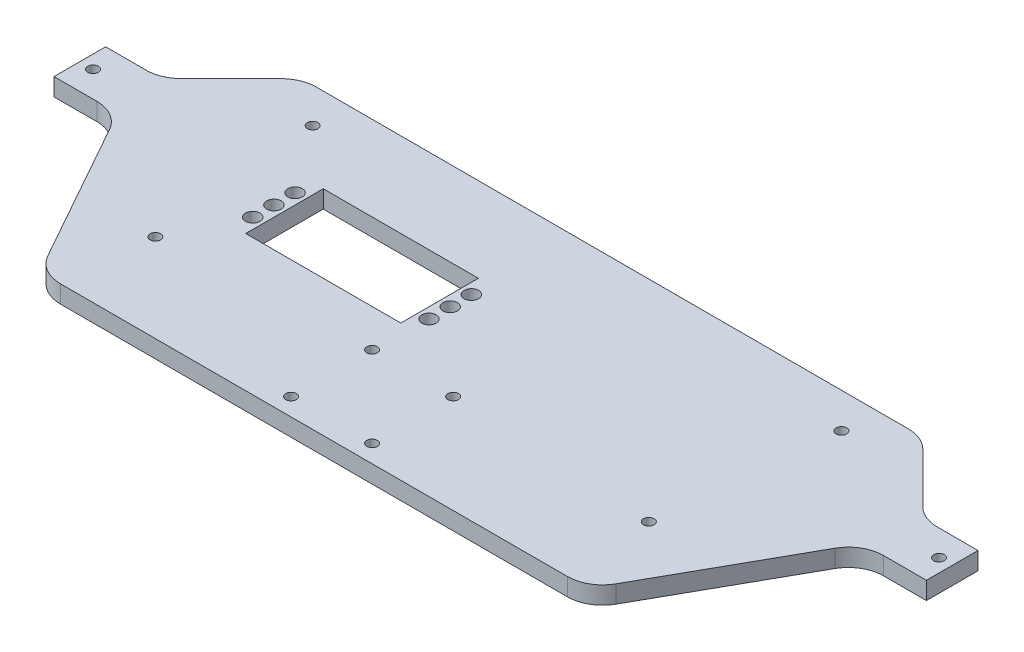
from build123d import *

# Parameters (mm, degrees)
SALIENTE_EXTRUIR1_DEPTH = 5
REDONDEO1_R             = 10
CROQUIS2_R              = 1.5
CROQUIS2_R_2            = 2.05
CROQUIS2_W              = 42
CROQUIS2_H              = 20
CORTAR_EXTRUIR1_DEPTH   = 135.669558943
CROQUIS3_W              = 4
CROQUIS3_H              = 14.636342218
CORTAR_EXTRUIR2_DEPTH   = 135.669558943
CROQUIS4_W              = 44
CROQUIS4_H              = 22
CORTAR_EXTRUIR3_DEPTH   = 131.881206084


with BuildPart() as part:
    # Croquis1 → Saliente-Extruir1 (new body)
    with BuildSketch(Plane(origin=(0, 0, 0), x_dir=(1, 0, 0), z_dir=(0, 1, 0))):
        Polygon((-88.1, 42.318171109), (88.1, 42.318171109), (108.1, 22.318171109), (127.75, 22.318171109), (127.75, 7.681828891), (105.75, 7.681828891), (77.75, -42.318171109), (-77.75, -42.318171109), (-105.75, 7.681828891), (-127.75, 7.681828891), (-127.75, 22.318171109), (-108.1, 22.318171109), align=None)
    extrude(amount=SALIENTE_EXTRUIR1_DEPTH)

    # Redondeo1
    redondeo1_edges = [part.edges().sort_by_distance(p)[0] for p in [
        (88.1, 2.5, -42.318171109),
        (-88.1, 2.5, -42.318171109),
        (-77.75, 2.5, 42.318171109),
        (77.75, 2.5, 42.318171109),
        (108.1, 2.5, -22.318171109),
        (105.75, 2.5, -7.681828891),
        (-105.75, 2.5, -7.681828891),
        (-108.1, 2.5, -22.318171109),
    ]]
    fillet(redondeo1_edges, radius=REDONDEO1_R)

    # Croquis2 → Cortar-Extruir1 (cut, through all)
    with BuildSketch(Plane(origin=(0, 5, 0), x_dir=(1, 0, 0), z_dir=(0, 1, 0))):
        with Locations((70, -17.318171109)):
            Circle(CROQUIS2_R)
        with Locations((-70, -17.318171109)):
            Circle(CROQUIS2_R)
        with Locations((-119.996067812, 15)):
            Circle(CROQUIS2_R)
        with Locations((119.996067812, 15)):
            Circle(CROQUIS2_R)
        with Locations((-75, 32.318171109)):
            Circle(CROQUIS2_R)
        with Locations((75, 32.318171109)):
            Circle(CROQUIS2_R)
        with Locations((-11.5, -14.318171109)):
            Circle(CROQUIS2_R)
        with Locations((11.5, -14.318171109)):
            Circle(CROQUIS2_R)
        with Locations((-11.5, -37.318171109)):
            Circle(CROQUIS2_R)
        with Locations((11.5, -37.318171109)):
            Circle(CROQUIS2_R)
        with Locations((-61, 7.318171109)):
            Circle(CROQUIS2_R_2)
        with Locations((-11, 7.318171109)):
            Circle(CROQUIS2_R_2)
        with Locations((-61, 13.318171109)):
            Circle(CROQUIS2_R_2)
        with Locations((-61, 1.318171109)):
            Circle(CROQUIS2_R_2)
        with Locations((-11, 13.318171109)):
            Circle(CROQUIS2_R_2)
        with Locations((-11, 1.318171109)):
            Circle(CROQUIS2_R_2)
        with Locations((-36, 7.318171109)):
            Rectangle(CROQUIS2_W, CROQUIS2_H)
    extrude(amount=-CORTAR_EXTRUIR1_DEPTH, mode=Mode.SUBTRACT)

    # Croquis3 → Cortar-Extruir2 (cut, through all)
    with BuildSketch(Plane(origin=(0, 5, 0), x_dir=(1, 0, 0), z_dir=(0, 1, 0))):
        with Locations((-125.75, 15)):
            Rectangle(CROQUIS3_W, CROQUIS3_H)
        with Locations((125.75, 15)):
            Rectangle(CROQUIS3_W, CROQUIS3_H)
    extrude(amount=-CORTAR_EXTRUIR2_DEPTH, mode=Mode.SUBTRACT)

    # Croquis4 → Cortar-Extruir3 (cut, through all)
    with BuildSketch(Plane(origin=(0, 5, 0), x_dir=(1, 0, 0), z_dir=(0, 1, 0))):
        with Locations((-36, 7.318171109)):
            Rectangle(CROQUIS4_W, CROQUIS4_H)
    extrude(amount=-CORTAR_EXTRUIR3_DEPTH, mode=Mode.SUBTRACT)


solid = part.part
